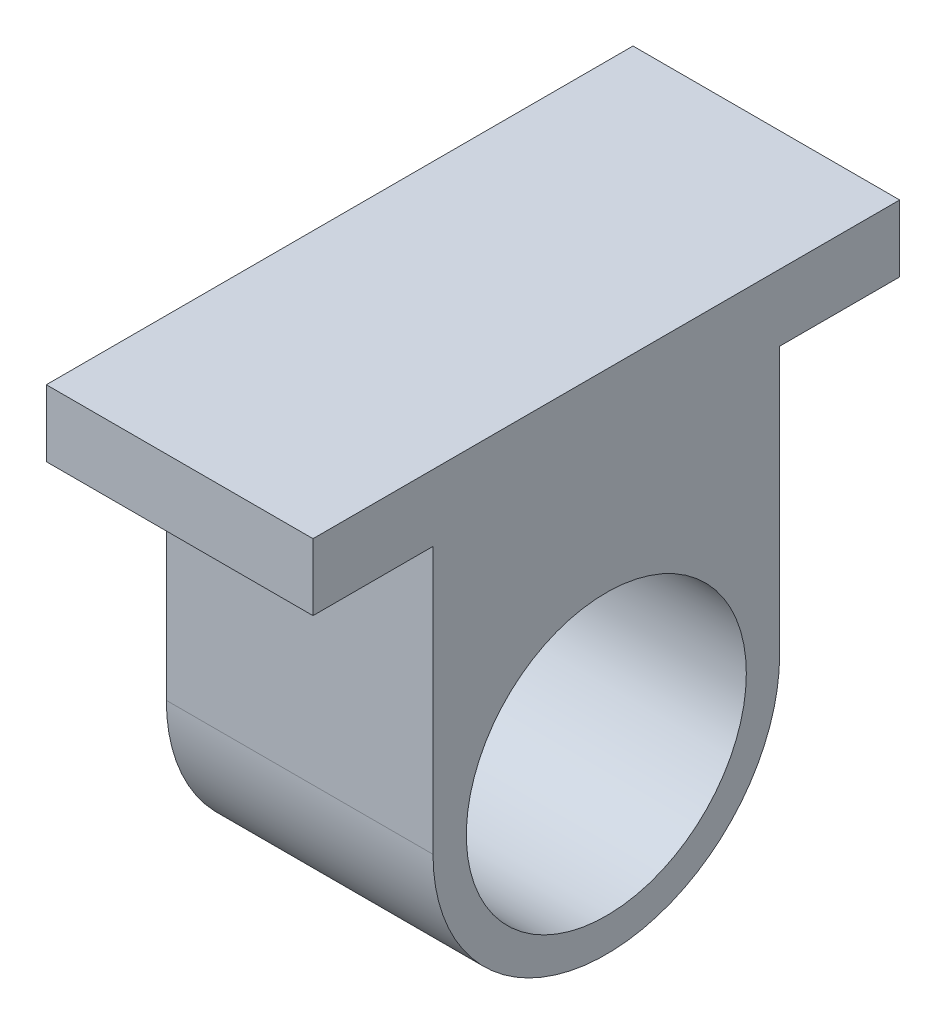
from build123d import *

# Parameters (mm, degrees)
EXTRUDE_START       = -20
EXTRUDE_1_OUTLINE_R = 10.5
EXTRUDE_1_DEPTH     = 20


# Read off the part's stored shape, not the designer's step: 填料-伸長1
with BuildPart() as part:
    # 填料-伸長1 outline → 填料-伸長1 (new body)
    with BuildSketch(Plane(origin=(26.04788271, 0, 0), x_dir=(0, 0, -1), z_dir=(1, 0, 0)).offset(EXTRUDE_START)):
        with BuildLine():
            Line((-201.999999965, -2.843045968), (-192.999999965, -2.843045968))
            Line((-192.999999965, -2.843045968), (-192.999999965, -22.843045968))
            ThreePointArc((-192.999999965, -22.843045968), (-179.999999965, -35.843045968), (-166.999999965, -22.843045968))
            Line((-166.999999965, -22.843045968), (-166.999999965, -2.843045968))
            Line((-166.999999965, -2.843045968), (-157.999999965, -2.843045968))
            Line((-157.999999965, -2.843045968), (-157.999999965, 2.156954032))
            Line((-157.999999965, 2.156954032), (-201.999999965, 2.156954032))
            Line((-201.999999965, 2.156954032), (-201.999999965, -2.843045968))
        make_face()
        with Locations((-179.999999965, -22.843045968)):
            Circle(EXTRUDE_1_OUTLINE_R, mode=Mode.SUBTRACT)
    extrude(amount=EXTRUDE_1_DEPTH)


solid = part.part
